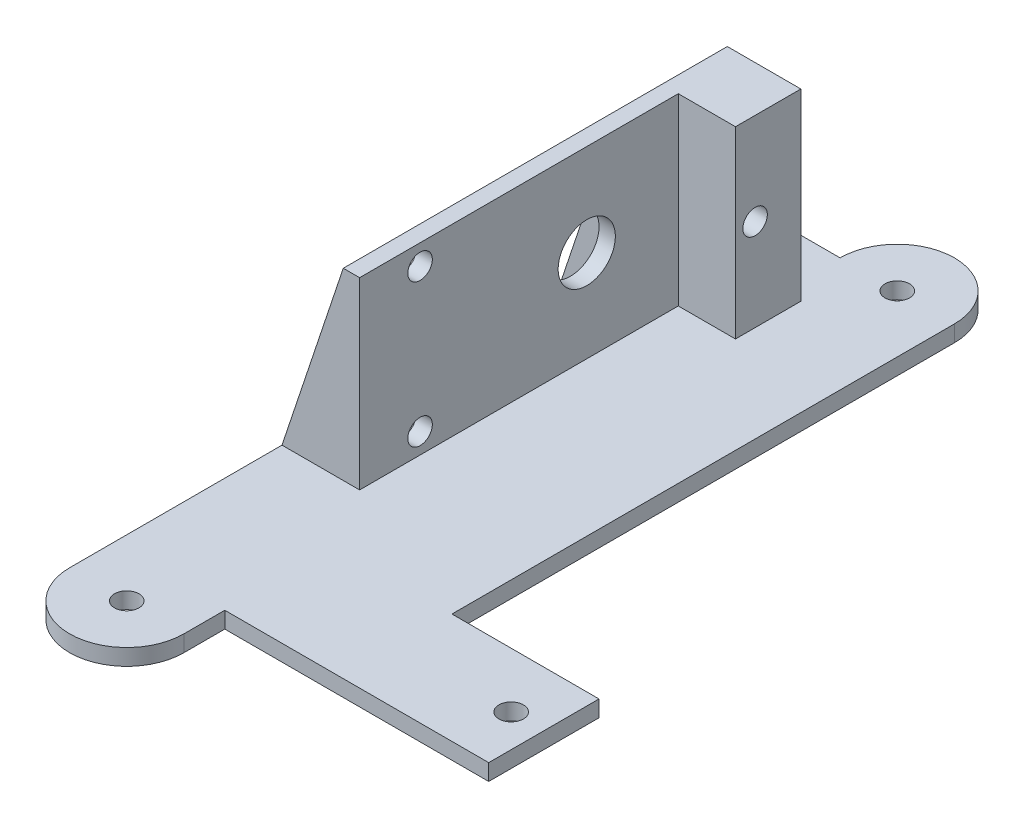
from build123d import *

# Parameters (mm, degrees)
BOSS_EXTRUDE3_DEPTH = 2
BOSS_EXTRUDE6_DEPTH = 22.5
SKETCH10_R          = 1.5
SKETCH10_R_2        = 3.5
CUT_EXTRUDE3_DEPTH  = 99.360002033
RIB6_START          = -3
RIB6_DEPTH          = 3
RIB7_START          = -1.5
RIB7_DEPTH          = 3
RIB8_DEPTH          = 3
SKETCH22_R          = 1.5
CUT_EXTRUDE5_DEPTH  = 102.088772868
SKETCH23_R          = 1.5
CUT_EXTRUDE6_DEPTH  = 102.088772868
SKETCH24_R          = 1.5
CUT_EXTRUDE7_DEPTH  = 10
SKETCH25_R          = 1.5
CUT_EXTRUDE8_DEPTH  = 10


# Read off the part's stored shape, not the designer's step: Rib6, Rib7, Rib8
with BuildPart() as part:
    # vlak basis → Boss-Extrude3 (new body)
    with BuildSketch(Plane(origin=(0, 0, 0), x_dir=(1, 0, 0), z_dir=(0, 1, 0))):
        with BuildLine():
            Line((-46.3, -61.5), (-46.3, -75))
            Line((-46.3, -75), (-14, -75))
            Line((-14, -75), (-14, -80))
            ThreePointArc((-14, -80), (-11.949747468, -84.949747468), (-7, -87))
            ThreePointArc((-7, -87), (-2.050252532, -84.949747468), (0, -80))
            Line((0, -80), (0, 0))
            Line((0, 0), (-14.3, 0))
            ThreePointArc((-14.3, 0), (-21.3, 7), (-28.3, 0))
            Line((-28.3, 0), (-28.3, -61.5))
            Line((-28.3, -61.5), (-46.3, -61.5))
        make_face()
    extrude(amount=BOSS_EXTRUDE3_DEPTH)

    # Sketch8 → Boss-Extrude6 (add)
    with BuildSketch(Plane(origin=(0, 2, 0), x_dir=(1, 0, 0), z_dir=(0, 1, 0))):
        Polygon((-16.5, -7), (-16.5, -15), (-9.5, -15), (-9.5, -54), (-7.5, -54), (-7.5, -7), align=None)
    extrude(amount=BOSS_EXTRUDE6_DEPTH)

    # Sketch10 → Cut-Extrude3 (cut, through all)
    with BuildSketch(Plane(origin=(-7.5, 0, 0), x_dir=(0, 0, -1), z_dir=(1, 0, 0))):
        with Locations((-46.6, 22)):
            Circle(SKETCH10_R)
        with Locations((-46.6, 4.5)):
            Circle(SKETCH10_R)
        with Locations((-26.2, 13.25)):
            Circle(SKETCH10_R_2)
        with Locations((-12.6, 13.25)):
            Circle(SKETCH10_R)
    extrude(amount=-CUT_EXTRUDE3_DEPTH, mode=Mode.SUBTRACT)

    # Rib6 outline → Rib6 (add)
    with BuildSketch(Plane.XY.offset(54).offset(RIB6_START)):
        Polygon((-7.5, 2), (0, 2), (-7.5, 24.5), align=None)
    extrude(amount=RIB6_DEPTH)

    # Rib7 outline → Rib7 (add)
    with BuildSketch(Plane.XY.offset(38).offset(RIB7_START)):
        Polygon((-7.5, 2), (0, 2), (-7.5, 24.5), align=None)
    extrude(amount=RIB7_DEPTH)

    # Rib8 outline → Rib8 (add)
    with BuildSketch(Plane.XY.offset(17)):
        Polygon((-7.5, 2), (0, 2), (-7.5, 24.5), align=None)
    extrude(amount=RIB8_DEPTH)

    # Sketch22 → Cut-Extrude5 (cut, through all)
    with BuildSketch(Plane(origin=(0, 2, 0), x_dir=(1, 0, 0), z_dir=(0, 1, 0))):
        with Locations(Location((-21.3, 0, 0), (0, 0, 270))):
            Circle(SKETCH22_R)
    extrude(amount=-CUT_EXTRUDE5_DEPTH, mode=Mode.SUBTRACT)

    # Sketch23 → Cut-Extrude6 (cut, through all)
    with BuildSketch(Plane(origin=(0, 2, 0), x_dir=(1, 0, 0), z_dir=(0, 1, 0))):
        with Locations(Location((-7, -80, 0), (0, 0, 270))):
            Circle(SKETCH23_R)
    extrude(amount=-CUT_EXTRUDE6_DEPTH, mode=Mode.SUBTRACT)

    # Sketch24 → Cut-Extrude7 (cut)
    with BuildSketch(Plane(origin=(0, 2, 0), x_dir=(1, 0, 0), z_dir=(0, 1, 0))):
        with Locations(Location((-42.3, -68.25, 0), (0, 0, 270))):
            Circle(SKETCH24_R)
    extrude(amount=-CUT_EXTRUDE7_DEPTH, mode=Mode.SUBTRACT)

    # Sketch25 → Cut-Extrude8 (cut)
    with BuildSketch(Plane(origin=(0, 2, 0), x_dir=(1, 0, 0), z_dir=(0, 1, 0))):
        with Locations(Location((-4, -4, 0), (0, 0, 270))):
            Circle(SKETCH25_R)
    extrude(amount=-CUT_EXTRUDE8_DEPTH, mode=Mode.SUBTRACT)


with BuildPart() as body_2:
    # Mirror1: mirrored copy
    add(part.part.mirror(Plane(origin=(0, 2, 80), x_dir=(0, 0, 1), z_dir=(-1, 0, 0))))


solid = body_2.part
